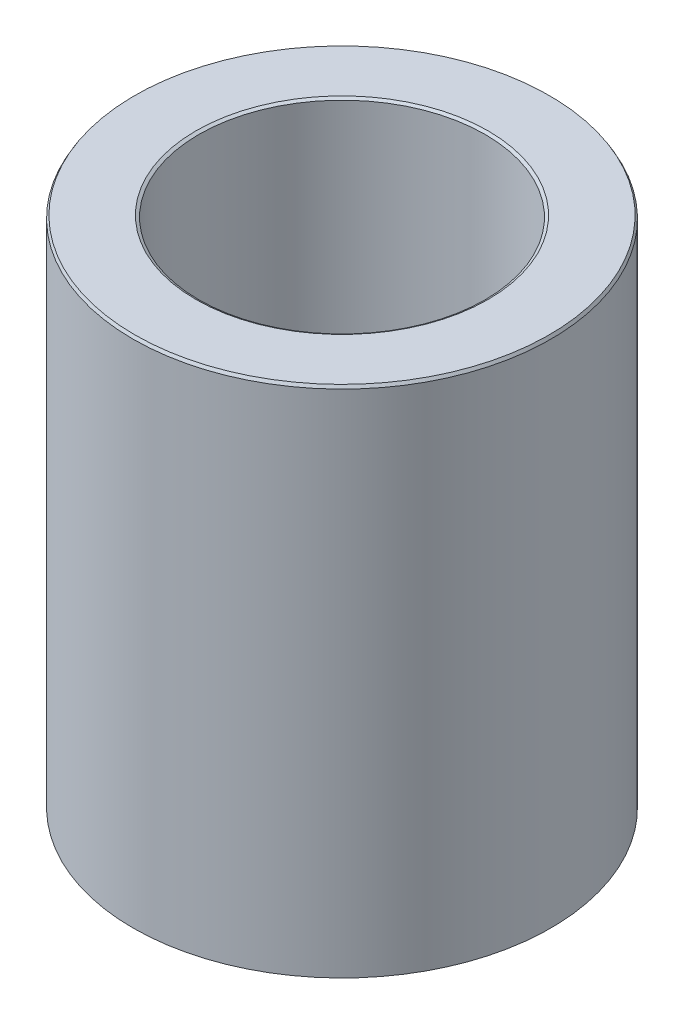
from build123d import *
from OCP.BRepFilletAPI import BRepFilletAPI_MakeChamfer

# Parameters (mm, degrees)
SKETCH1_R           = 47.5
BOSS_EXTRUDE1_DEPTH = 116.98357952
SKETCH2_R           = 32.550227119
CUT_EXTRUDE1_DEPTH  = 135.898694869
CHAMFER1_SIZE       = 0.66080401
CHAMFER1_SIZE2      = 0.381515373


with BuildPart() as part:
    # Sketch1 → Boss-Extrude1 (new body)
    with BuildSketch(Plane(origin=(0, 0, 0), x_dir=(1, 0, 0), z_dir=(0, 1, 0))):
        Circle(SKETCH1_R)
    extrude(amount=BOSS_EXTRUDE1_DEPTH)

    # Sketch2 → Cut-Extrude1 (cut, through all)
    with BuildSketch(Plane(origin=(0, 0, 0), x_dir=(1, 0, 0), z_dir=(0, 1, 0))):
        Circle(SKETCH2_R)
    extrude(amount=CUT_EXTRUDE1_DEPTH, mode=Mode.SUBTRACT)

    # Chamfer1: one chamfer whose edges measure the first distance from different faces: ONE call of the kernel's chamfer builder (chamfer() names one face for all edges)
    chamfer1_edges_1 = [part.edges().sort_by_distance(p)[0] for p in [
        (-32.550227119, 116.98357952, 0),
    ]]
    chamfer1_side_1 = [part.faces().sort_by_distance(p)[0] for p in [
        (-46.156497116, 116.98357952, 0),
    ]]
    chamfer1_edges_2 = [part.edges().sort_by_distance(p)[0] for p in [
        (-32.550227119, 0, 0),
    ]]
    chamfer1_side_2 = [part.faces().sort_by_distance(p)[0] for p in [
        (-32.550227119, 58.49178976, 0),
    ]]
    chamfer1_edges_3 = [part.edges().sort_by_distance(p)[0] for p in [
        (-47.5, 0, 0),
    ]]
    chamfer1_side_3 = [part.faces().sort_by_distance(p)[0] for p in [
        (-46.156497116, 0, 0),
    ]]
    chamfer1_edges_4 = [part.edges().sort_by_distance(p)[0] for p in [
        (-47.5, 116.98357952, 0),
    ]]
    chamfer1_side_4 = [part.faces().sort_by_distance(p)[0] for p in [
        (-47.5, 58.49178976, 0),
    ]]
    chamfer1 = BRepFilletAPI_MakeChamfer(part.part.solid().wrapped)
    for e in chamfer1_edges_1:
        chamfer1.Add(CHAMFER1_SIZE, CHAMFER1_SIZE2, e.wrapped, chamfer1_side_1[0].wrapped)  # the first distance lies on this face
    for e in chamfer1_edges_2:
        chamfer1.Add(CHAMFER1_SIZE, CHAMFER1_SIZE2, e.wrapped, chamfer1_side_2[0].wrapped)  # the first distance lies on this face
    for e in chamfer1_edges_3:
        chamfer1.Add(CHAMFER1_SIZE, CHAMFER1_SIZE2, e.wrapped, chamfer1_side_3[0].wrapped)  # the first distance lies on this face
    for e in chamfer1_edges_4:
        chamfer1.Add(CHAMFER1_SIZE, CHAMFER1_SIZE2, e.wrapped, chamfer1_side_4[0].wrapped)  # the first distance lies on this face
    add(Compound.cast(chamfer1.Shape()), mode=Mode.REPLACE)


solid = part.part
